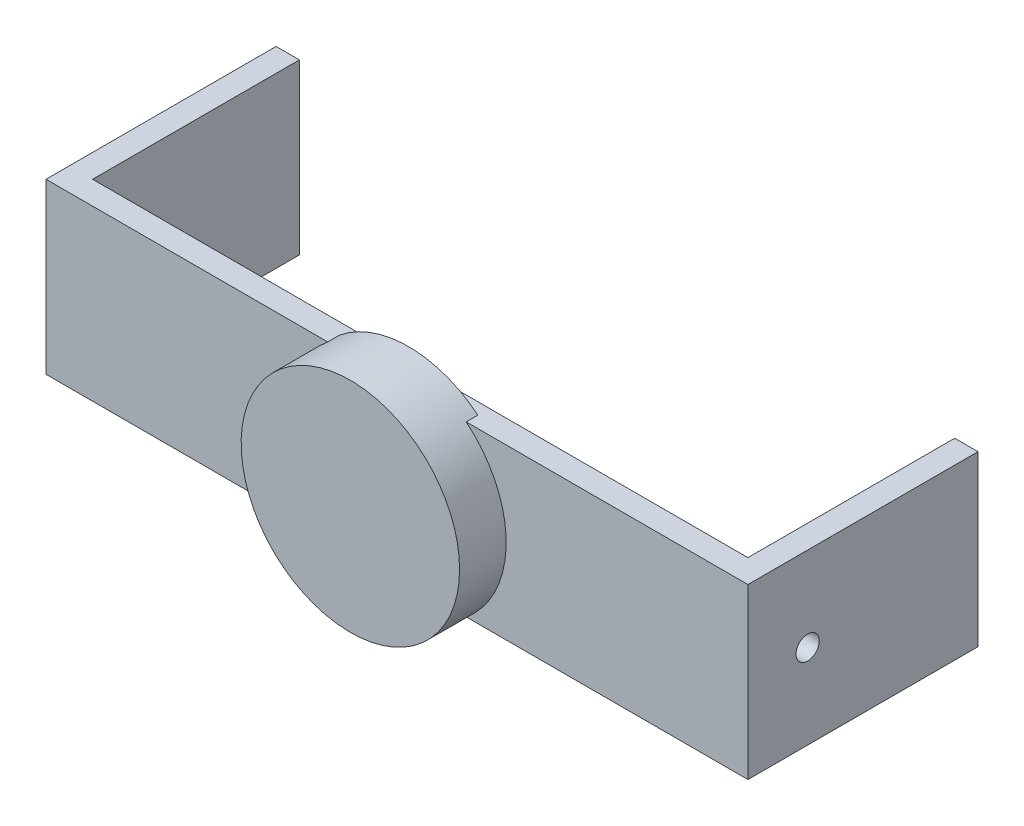
from build123d import *

# Parameters (mm, degrees)
SKETCH1_R           = 75
BOSS_EXTRUDE1_DEPTH = 40
SKETCH2_W           = 482
SKETCH2_H           = 116
BOSS_EXTRUDE2_DEPTH = 16
SKETCH3_W           = 147
SKETCH3_H           = 116
BOSS_EXTRUDE3_DEPTH = 16
SKETCH4_W           = 147
SKETCH4_H           = 116
BOSS_EXTRUDE4_DEPTH = 16
SKETCH5_R           = 8
CUT_EXTRUDE1_DEPTH  = 502


with BuildPart() as part:
    # Sketch1 → Boss-Extrude1 (new body)
    with BuildSketch(Plane.XY.offset(190)):
        with Locations((300, 300)):
            Circle(SKETCH1_R)
    extrude(amount=BOSS_EXTRUDE1_DEPTH)

    # Sketch2 → Boss-Extrude2 (add)
    with BuildSketch(Plane.XY.offset(182)):
        with Locations((300, 300)):
            Rectangle(SKETCH2_W, SKETCH2_H)
    extrude(amount=BOSS_EXTRUDE2_DEPTH)

    # Sketch3 → Boss-Extrude3 (add)
    with BuildSketch(Plane(origin=(525, 0, 0), x_dir=(0, 0, -1), z_dir=(1, 0, 0))):
        with Locations((-113.5, 300)):
            Rectangle(SKETCH3_W, SKETCH3_H)
    extrude(amount=BOSS_EXTRUDE3_DEPTH)

    # Sketch4 → Boss-Extrude4 (add)
    with BuildSketch(Plane(origin=(59, 0, 0), x_dir=(0, 0, -1), z_dir=(1, 0, 0))):
        with Locations((-113.5, 300)):
            Rectangle(SKETCH4_W, SKETCH4_H)
    extrude(amount=BOSS_EXTRUDE4_DEPTH)

    # Sketch5 → Cut-Extrude1 (cut)
    with BuildSketch(Plane(origin=(541, 0, 0), x_dir=(0, 0, -1), z_dir=(1, 0, 0))):
        with Locations((-157, 300)):
            Circle(SKETCH5_R)
    extrude(amount=-CUT_EXTRUDE1_DEPTH, mode=Mode.SUBTRACT)


solid = part.part
